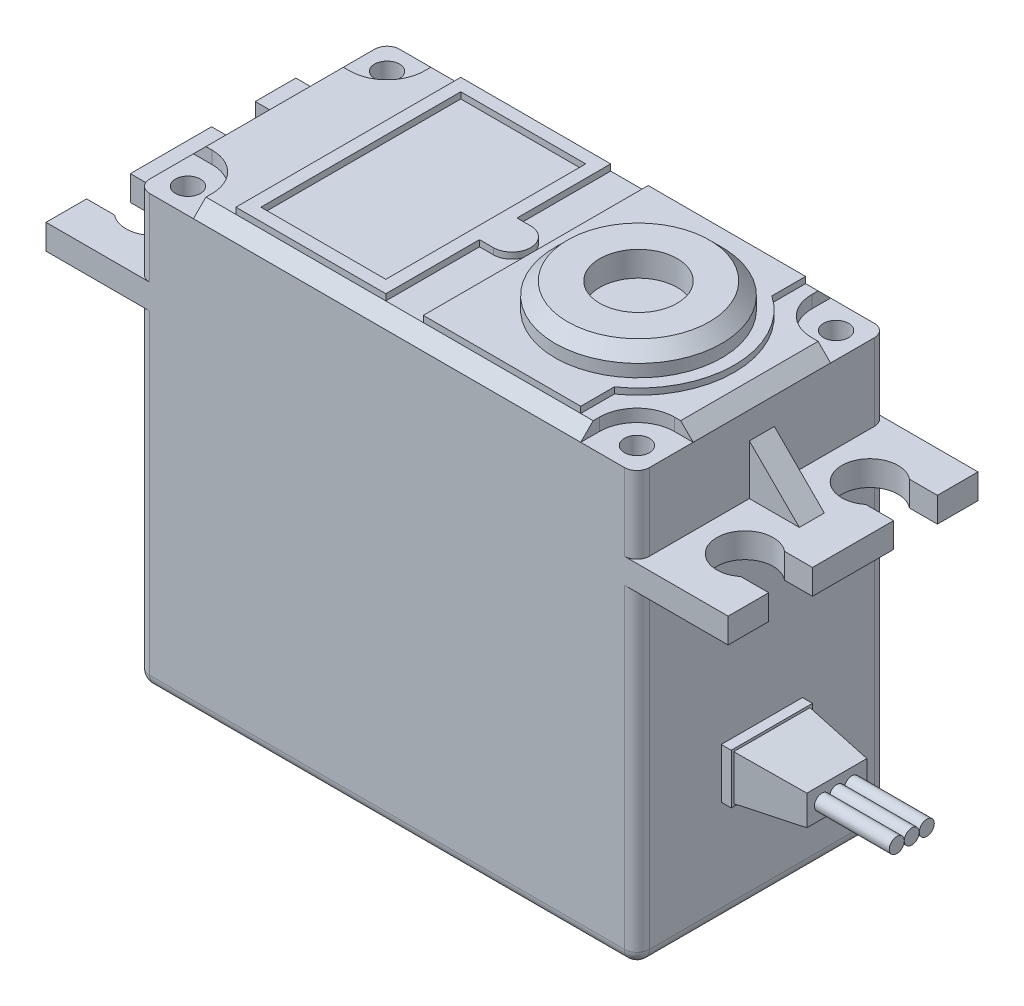
from build123d import *

# Parameters (mm, degrees)
SKETCH_1_W              = 40
SKETCH_1_H              = 20
EXTRUDE_1_DEPTH         = 35.4
SKETCH_2_W              = 7.3
SKETCH_2_H              = 2
EXTRUDE_2_DEPTH         = 20
SKETCH_3_R              = 2.25
CUT_EXTRUDE_1_DEPTH     = 35.4
SKETCH_4_R              = 6.675
EXTRUDE_3_DEPTH         = 0.5
SKETCH_4_3_R            = 6.675
EXTRUDE_4_DEPTH         = 2.5
EXTRUDE_2_2_OUTLINE_W   = 12
EXTRUDE_2_2_OUTLINE_H   = 18
EXTRUDE_2_2_OUTLINE_W_2 = 10
EXTRUDE_2_2_OUTLINE_H_2 = 16
EXTRUDE_2_2_DEPTH       = 0.5
EXTRUDE_6_DEPTH         = 0.5
SKETCH_13_W             = 6.5
SKETCH_13_H             = 4
EXTRUDE_8_DEPTH         = 6
CUT_EXTRUDE_5_DEPTH     = 49.551647758
CUT_EXTRUDE_6_DEPTH     = 6
SKETCH_17_R             = 0.6
EXTRUDE_11_DEPTH        = 6
EXTRUDE_11_2_DEPTH      = 6
EXTRUDE_11_3_DEPTH      = 6
SKETCH_18_W             = 2
SKETCH_18_H             = 4
EXTRUDE_12_DEPTH        = 4
CUT_EXTRUDE_7_DEPTH     = 4
CHAMFER_2_SIZE          = 1
SKETCH_21_R             = 3.1
CUT_EXTRUDE_8_DEPTH     = 2
SKETCH_23_W             = 4.5
SKETCH_23_H             = 4.5
CUT_EXTRUDE_9_DEPTH     = 1
FILLET_3_R              = 3
SKETCH_24_R             = 1
CUT_EXTRUDE_10_DEPTH    = 2
CHAMFER_3_SIZE          = 1
FILLET_6_R              = 1
FILLET_7_R              = 1


# Read off the part's stored shape, not the designer's step: 押し出し-薄板2
with BuildPart() as part:
    # ｽｹｯﾁ1 → ﾎﾞｽ - 押し出し1 (new body)
    with BuildSketch(Plane(origin=(0, 0, 0), x_dir=(1, 0, 0), z_dir=(0, 1, 0))):
        Rectangle(SKETCH_1_W, SKETCH_1_H)
    extrude_1 = extrude(amount=EXTRUDE_1_DEPTH)

    # ｽｹｯﾁ2 → Extrude 2 (add)
    with BuildSketch(Plane.XY.offset(10)):
        with Locations((23.65, 27.25)):
            Rectangle(SKETCH_2_W, SKETCH_2_H)
        with Locations((-23.65, 27.25)):
            Rectangle(SKETCH_2_W, SKETCH_2_H)
    extrude(amount=-EXTRUDE_2_DEPTH)

    # ｽｹｯﾁ3 → ｶｯﾄ - 押し出し1 (cut)
    with BuildSketch(Plane(origin=(0, 28.25, 0), x_dir=(1, 0, 0), z_dir=(0, 1, 0))):
        with Locations((23.65, -5)):
            Circle(SKETCH_3_R)
        with BuildLine():
            Line((25.064213562, -6.75), (27.3, -6.75))
            Line((27.3, -6.75), (27.3, -3.25))
            Line((27.3, -3.25), (25.064213562, -3.25))
            ThreePointArc((25.064213562, -3.25), (25.680330086, -4.030330086), (25.9, -5))
            ThreePointArc((25.9, -5), (25.680330086, -5.969669914), (25.064213562, -6.75))
        make_face()
        with Locations((23.65, 5)):
            Circle(SKETCH_3_R)
        with BuildLine():
            Line((27.3, 3.25), (27.3, 6.75))
            Line((27.3, 6.75), (25.064213562, 6.75))
            ThreePointArc((25.064213562, 6.75), (25.680330086, 5.969669914), (25.9, 5))
            ThreePointArc((25.9, 5), (25.680330086, 4.030330086), (25.064213562, 3.25))
            Line((25.064213562, 3.25), (27.3, 3.25))
        make_face()
        with Locations((-23.65, -5)):
            Circle(SKETCH_3_R)
        with BuildLine():
            Line((-27.3, -3.25), (-27.3, -6.75))
            Line((-27.3, -6.75), (-25.064213562, -6.75))
            ThreePointArc((-25.064213562, -6.75), (-25.9, -5), (-25.064213562, -3.25))
            Line((-25.064213562, -3.25), (-27.3, -3.25))
        make_face()
        with Locations((-23.65, 5)):
            Circle(SKETCH_3_R)
        with BuildLine():
            Line((-27.3, 6.75), (-27.3, 3.25))
            Line((-27.3, 3.25), (-25.064213562, 3.25))
            ThreePointArc((-25.064213562, 3.25), (-25.9, 5), (-25.064213562, 6.75))
            Line((-25.064213562, 6.75), (-27.3, 6.75))
        make_face()
    extrude(amount=-CUT_EXTRUDE_1_DEPTH, mode=Mode.SUBTRACT)

    # ｽｹｯﾁ4 → ﾎﾞｽ - 押し出し3 (add)
    with BuildSketch(Plane(origin=(0, 35.4, 0), x_dir=(1, 0, 0), z_dir=(0, 1, 0))):
        with BuildLine():
            Line((1.9, -9), (14.5, -9))
            Line((14.5, -9), (14.5, -6.306493844))
            ThreePointArc((14.5, -6.306493844), (17.800447192, 0), (14.5, 6.306493844))
            Line((14.5, 6.306493844), (14.5, 9))
            Line((14.5, 9), (1.9, 9))
            Line((1.9, 9), (1.9, -9))
        make_face()
        with Locations(Location((10.125, 0, 0), (0, 0, 270))):
            Circle(SKETCH_4_R, mode=Mode.SUBTRACT)
    extrude(amount=EXTRUDE_3_DEPTH)

    # ｽｹｯﾁ4<3> → ﾎﾞｽ - 押し出し4 (add)
    with BuildSketch(Plane(origin=(0, 35.4, 0), x_dir=(1, 0, 0), z_dir=(0, 1, 0))):
        with Locations(Location((10.125, 0, 0), (0, 0, 270))):
            Circle(SKETCH_4_3_R)
    extrude(amount=EXTRUDE_4_DEPTH)

    # Extrude 2 2 outline → Extrude 2 2 (add)
    with BuildSketch(Plane(origin=(0, 35.4, 0), x_dir=(1, 0, 0), z_dir=(0, 1, 0))):
        with Locations((-7.1, 0)):
            Rectangle(EXTRUDE_2_2_OUTLINE_W, EXTRUDE_2_2_OUTLINE_H)
        with Locations((-7.1, 0)):
            Rectangle(EXTRUDE_2_2_OUTLINE_W_2, EXTRUDE_2_2_OUTLINE_H_2, mode=Mode.SUBTRACT)
    extrude(amount=EXTRUDE_2_2_DEPTH)

    # ｽｹｯﾁ4<6> → ﾎﾞｽ - 押し出し6 (add)
    with BuildSketch(Plane(origin=(0, 35.4, 0), x_dir=(1, 0, 0), z_dir=(0, 1, 0))):
        with BuildLine():
            Line((-1.1, 1.5), (-1.1, -1.5))
            Line((-1.1, -1.5), (0, -1.5))
            ThreePointArc((0, -1.5), (1.5, 0), (0, 1.5))
            Line((0, 1.5), (-1.1, 1.5))
        make_face()
    extrude(amount=EXTRUDE_6_DEPTH)

    # ｽｹｯﾁ13 → ﾎﾞｽ - 押し出し8 (add)
    with BuildSketch(Plane(origin=(20, 0, 0), x_dir=(0, 0, -1), z_dir=(1, 0, 0))):
        with Locations((0, 10.330544448)):
            Rectangle(SKETCH_13_W, SKETCH_13_H)
    extrude(amount=EXTRUDE_8_DEPTH)

    # ｽｹｯﾁ14 → ｶｯﾄ - 押し出し5 (cut, through all)
    with BuildSketch(Plane.XY.offset(3.25)):
        Polygon((20.8, 8.530544448), (20.8, 8.330544448), (26, 8.330544448), (26, 9.130544448), align=None)
        Polygon((26, 12.330544448), (20.8, 12.330544448), (20.8, 12.130544448), (26, 11.530544448), align=None)
    extrude(amount=-CUT_EXTRUDE_5_DEPTH, mode=Mode.SUBTRACT)

    # ｽｹｯﾁ15 → ｶｯﾄ - 押し出し6 (cut)
    with BuildSketch(Plane.XZ.offset(-8.330544448)):
        Polygon((20.8, 3.25), (20.8, 3.05), (26, 2.4), (26, 3.25), align=None)
        Polygon((20.8, -3.05), (20.8, -3.25), (26, -3.25), (26, -2.4), align=None)
    extrude(amount=-CUT_EXTRUDE_6_DEPTH, mode=Mode.SUBTRACT)

    # ｽｹｯﾁ18 → ﾎﾞｽ - 押し出し12 (add)
    with BuildSketch(Plane.ZY.offset(20)):
        with Locations((0, 30.25)):
            Rectangle(SKETCH_18_W, SKETCH_18_H)
    extrude_12 = extrude(amount=EXTRUDE_12_DEPTH)

    # ｽｹｯﾁ19 → ｶｯﾄ - 押し出し7 (cut)
    with BuildSketch(Plane(origin=(0, 0, -1), x_dir=(-1, 0, 0), z_dir=(0, 0, -1))):
        Polygon((24, 28.25), (20, 32.25), (24, 32.25), align=None)
    cut_extrude_7 = extrude(amount=-CUT_EXTRUDE_7_DEPTH, mode=Mode.SUBTRACT)

    # ﾐﾗｰ5: ﾎﾞｽ - 押し出し1, ﾎﾞｽ - 押し出し12, ｶｯﾄ - 押し出し7 across plane
    add(extrude_1.mirror(Plane.ZY))
    add(extrude_12.mirror(Plane.ZY))
    add(cut_extrude_7.mirror(Plane.ZY), mode=Mode.SUBTRACT)

    # 面取り2
    chamfer_2_edges = [part.edges().sort_by_distance(p)[0] for p in [
        (10.125, 37.9, -6.675),
    ]]
    chamfer(chamfer_2_edges, length=CHAMFER_2_SIZE)

    # ｽｹｯﾁ21 → ｶｯﾄ - 押し出し8 (cut)
    with BuildSketch(Plane(origin=(0, 37.9, 0), x_dir=(1, 0, 0), z_dir=(0, 1, 0))):
        with Locations(Location((10.125, 0, 0), (0, 0, 270))):
            Circle(SKETCH_21_R)
    extrude(amount=-CUT_EXTRUDE_8_DEPTH, mode=Mode.SUBTRACT)

    # ｽｹｯﾁ23 → ｶｯﾄ - 押し出し9 (cut)
    with BuildSketch(Plane(origin=(0, 35.4, 0), x_dir=(1, 0, 0), z_dir=(0, 1, 0))):
        with Locations((-17.75, -7.75)):
            Rectangle(SKETCH_23_W, SKETCH_23_H)
        with Locations((-17.75, 7.75)):
            Rectangle(SKETCH_23_W, SKETCH_23_H)
        with Locations((17.75, 7.75)):
            Rectangle(SKETCH_23_W, SKETCH_23_H)
        with Locations((17.75, -7.75)):
            Rectangle(SKETCH_23_W, SKETCH_23_H)
    extrude(amount=-CUT_EXTRUDE_9_DEPTH, mode=Mode.SUBTRACT)

    # ﾌｨﾚｯﾄ3
    fillet_3_edges = [part.edges().sort_by_distance(p)[0] for p in [
        (-15.5, 34.9, 5.5),
        (-15.5, 34.9, -5.5),
        (15.5, 34.9, -5.5),
        (15.5, 34.9, 5.5),
    ]]
    fillet(fillet_3_edges, radius=FILLET_3_R)

    # ｽｹｯﾁ24 → ｶｯﾄ - 押し出し10 (cut)
    with BuildSketch(Plane(origin=(0, 34.4, 0), x_dir=(1, 0, 0), z_dir=(0, 1, 0))):
        with Locations(Location((-17.969669914, 7.969669914, 0), (0, 0, 270))):
            Circle(SKETCH_24_R)
        with Locations(Location((-17.969669914, -7.969669914, 0), (0, 0, 270))):
            Circle(SKETCH_24_R)
        with Locations(Location((17.969669914, -7.969669914, 0), (0, 0, 270))):
            Circle(SKETCH_24_R)
        with Locations(Location((17.969669914, 7.969669914, 0), (0, 0, 270))):
            Circle(SKETCH_24_R)
    extrude(amount=-CUT_EXTRUDE_10_DEPTH, mode=Mode.SUBTRACT)

    # 面取り3
    chamfer_3_edges = [part.edges().sort_by_distance(p)[0] for p in [
        (20, 35.4, 0),
        (0, 35.4, 10),
        (-20, 35.4, 0),
        (0, 35.4, -10),
    ]]
    chamfer(chamfer_3_edges, length=CHAMFER_3_SIZE - 0.0001)  # a hair under: the kernel refuses the full size

    # ﾌｨﾚｯﾄ6
    fillet_6_edges = [part.edges().sort_by_distance(p)[0] for p in [
        (20, 13.125, 10),
        (20, 31.325, 10),
        (-20, 13.125, 10),
        (-20, 31.325, 10),
        (-20, 13.125, -10),
        (-20, 31.325, -10),
        (20, 31.325, -10),
        (20, 13.125, -10),
    ]]
    fillet(fillet_6_edges, radius=FILLET_6_R)

    # ﾌｨﾚｯﾄ7
    fillet_7_edges = [part.edges().sort_by_distance(p)[0] for p in [
        (20, 0, 0),
        (-20, 0, 0),
        (0, 0, -10),
        (0, 0, 10),
        (19.707106781, 0, -9.707106781),
        (-19.707106781, 0, -9.707106781),
        (-19.707106781, 0, 9.707106781),
        (19.707106781, 0, 9.707106781),
    ]]
    fillet(fillet_7_edges, radius=FILLET_7_R)


with BuildPart() as body_2:
    # ｽｹｯﾁ17 → ﾎﾞｽ - 押し出し11 (new body)
    with BuildSketch(Plane(origin=(26, 0, 0), x_dir=(0, 0, -1), z_dir=(1, 0, 0))):
        with Locations((-1.2, 10.330544448)):
            Circle(SKETCH_17_R)
    extrude(amount=EXTRUDE_11_DEPTH)


with BuildPart() as body_3:
    # ｽｹｯﾁ17 → Extrude 11 2 (new body)
    with BuildSketch(Plane(origin=(26, 0, 0), x_dir=(0, 0, -1), z_dir=(1, 0, 0))):
        with Locations((0, 10.330544448)):
            Circle(SKETCH_17_R)
    extrude(amount=EXTRUDE_11_2_DEPTH)


with BuildPart() as body_4:
    # ｽｹｯﾁ17 → Extrude 11 3 (new body)
    with BuildSketch(Plane(origin=(26, 0, 0), x_dir=(0, 0, -1), z_dir=(1, 0, 0))):
        with Locations((1.2, 10.330544448)):
            Circle(SKETCH_17_R)
    extrude(amount=EXTRUDE_11_3_DEPTH)


solid = Compound([part.part, body_2.part, body_3.part, body_4.part])
